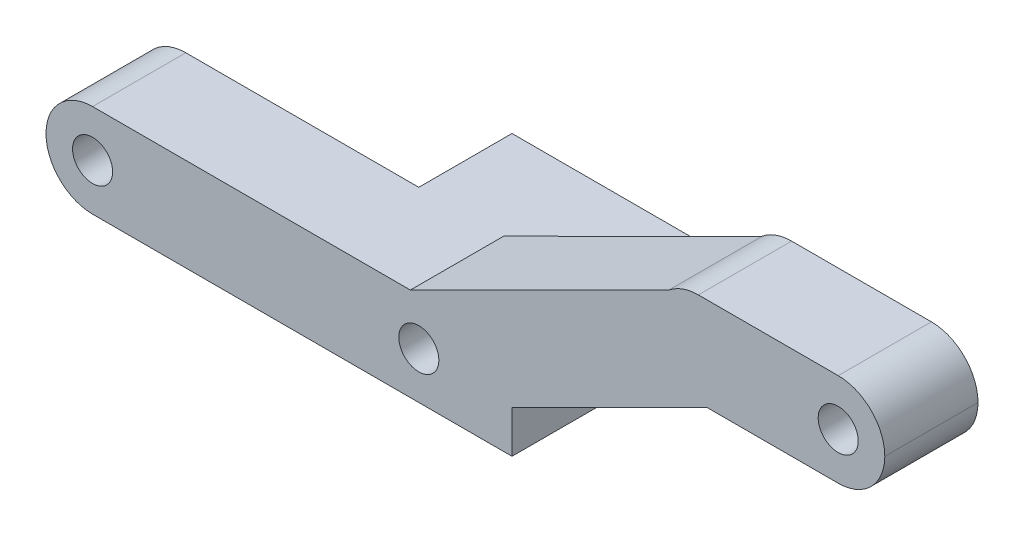
from build123d import *

# Parameters (mm, degrees)
EXTRUDE_1_DEPTH     = 10
SKETCH_3_W          = 20
SKETCH_3_H          = 10
EXTRUDE_2_DEPTH     = 20
FILLET_1_R          = 5
SKETCH_5_R          = 2.15
CUT_EXTRUDE_2_DEPTH = 78.821912081
SKETCH_9_R          = 1
CUT_EXTRUDE_4_DEPTH = 8
SKETCH_10_R         = 5
CUT_EXTRUDE_8_DEPTH = 2


with BuildPart() as part:
    # 스케치2 → 보스-돌출1 (new body)
    with BuildSketch(Plane.XY):
        with BuildLine():
            Line((70, 27.5), (70, 17.5))
            Line((70, 17.5), (50.905124838, 17.5))
            Line((50.905124838, 17.5), (23.200921998, 3.658893602))
            ThreePointArc((23.200921998, 3.658893602), (21.702126319, 2.798642112), (20, 2.5))
            Line((20, 2.5), (-20, 2.5))
            Line((-20, 2.5), (-20, 12.5))
            Line((-20, 12.5), (19.094875162, 12.5))
            Line((19.094875162, 12.5), (46.799078002, 26.341106398))
            ThreePointArc((46.799078002, 26.341106398), (48.297873681, 27.201357888), (50, 27.5))
            Line((50, 27.5), (70, 27.5))
        make_face()
    extrude(amount=EXTRUDE_1_DEPTH)

    # 스케치3 → 보스-돌출2 (add)
    with BuildSketch(Plane.XY.offset(10)):
        with Locations((19.999999999, 7.5)):
            Rectangle(SKETCH_3_W, SKETCH_3_H)
    extrude(amount=-EXTRUDE_2_DEPTH)

    # 필렛1
    fillet_1_edges = [part.edges().sort_by_distance(p)[0] for p in [
        (-20, 12.5, 5),
        (-20, 2.5, 5),
        (70, 17.5, 5),
        (70, 27.5, 5),
    ]]
    fillet(fillet_1_edges, radius=FILLET_1_R - 0.0001)  # a hair under: the kernel refuses the full size

    # 스케치5 → 컷-돌출2 (cut, through all)
    with BuildSketch(Plane(origin=(0, 0, -10), x_dir=(-1, 0, 0), z_dir=(0, 0, -1))):
        with Locations((-19.999999999, 7.5)):
            Circle(SKETCH_5_R)
        with Locations((-65, 22.5)):
            Circle(SKETCH_5_R)
        with Locations((15, 7.5)):
            Circle(SKETCH_5_R)
    extrude(amount=-CUT_EXTRUDE_2_DEPTH, mode=Mode.SUBTRACT)

    # 스케치9 → 컷-돌출4 (cut)
    with BuildSketch(Plane.XZ.offset(-2.5)):
        with Locations(Location((12.499999999, 7.5, 0), (0, 0, 270))):
            Circle(SKETCH_9_R)
        with Locations(Location((27.499999999, 7.5, 0), (0, 0, 270))):
            Circle(SKETCH_9_R)
        with Locations(Location((12.499999999, -7.5, 0), (0, 0, 270))):
            Circle(SKETCH_9_R)
        with Locations(Location((27.499999999, -7.5, 0), (0, 0, 270))):
            Circle(SKETCH_9_R)
    extrude(amount=-CUT_EXTRUDE_4_DEPTH, mode=Mode.SUBTRACT)

    # 스케치10 → 컷-돌출8 (cut)
    with BuildSketch(Plane.XZ.offset(-2.5)):
        with Locations(Location((19.999999999, 0, 0), (0, 0, 270))):
            Circle(SKETCH_10_R)
    extrude(amount=-CUT_EXTRUDE_8_DEPTH, mode=Mode.SUBTRACT)


solid = part.part
